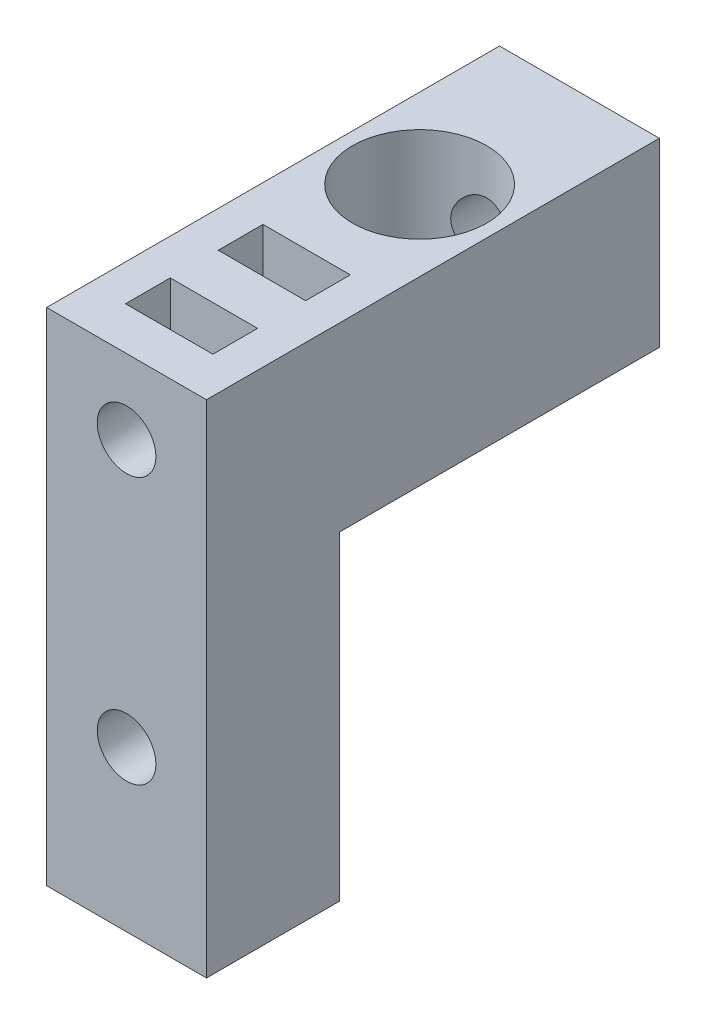
from build123d import *

# Parameters (mm, degrees)
SKETCH1_W                                       = 15
SKETCH1_H                                       = 47
BOSS_EXTRUDE1_DEPTH                             = 42.5
SKETCH2_W                                       = 30
SKETCH2_H                                       = 30
CUT_EXTRUDE1_DEPTH                              = 66.117202028
SKETCH3_R                                       = 2.75
CUT_EXTRUDE2_DEPTH                              = 15
CUT_EXTRUDE3_REACH                              = 67.117
SKETCH4_R                                       = 3.25
SKETCH5_R                                       = 2.75
CUT_EXTRUDE4_DEPTH                              = 57.482298112
CUT_EXTRUDE6_START                              = -7.2
SKETCH6_R                                       = 6.3
CUT_EXTRUDE6_DEPTH                              = 15
CSK_FOR_M6_FLAT_HEAD_MACHINE_SCREW1_D           = 6.6
CSK_FOR_M6_FLAT_HEAD_MACHINE_SCREW1_CSINK_D     = 12.6
CSK_FOR_M6_FLAT_HEAD_MACHINE_SCREW1_CSINK_ANGLE = 90
SKETCH10_W                                      = 8.2
SKETCH10_H                                      = 4.2
CUT_EXTRUDE7_DEPTH                              = 12


with BuildPart() as part:
    # Sketch1 → Boss-Extrude1 (new body)
    with BuildSketch(Plane.XY):
        with Locations((7.5, 23.5)):
            Rectangle(SKETCH1_W, SKETCH1_H)
    extrude(amount=BOSS_EXTRUDE1_DEPTH)

    # Sketch2 → Cut-Extrude1 (cut, through all)
    with BuildSketch(Plane.ZY):
        with Locations((15, 15)):
            Rectangle(SKETCH2_W, SKETCH2_H)
    extrude(amount=-CUT_EXTRUDE1_DEPTH, mode=Mode.SUBTRACT)

    # Sketch3 → Cut-Extrude2 (cut)
    with BuildSketch(Plane.XY.offset(42.5)):
        with Locations((7.5, 15)):
            Circle(SKETCH3_R)
        with Locations((7.5, 40)):
            Circle(SKETCH3_R)
    extrude(amount=-CUT_EXTRUDE2_DEPTH, mode=Mode.SUBTRACT)

    # Sketch4 → Cut-Extrude3 (cut, up to next)
    with BuildSketch(Plane(origin=(0, 47, 0), x_dir=(1, 0, 0), z_dir=(0, 1, 0)), mode=Mode.PRIVATE) as cut_extrude3_sk1:
        with Locations((7.5, -15)):
            Circle(SKETCH4_R)
    cut_extrude3_tool1 = extrude(cut_extrude3_sk1.sketch, amount=-CUT_EXTRUDE3_REACH, mode=Mode.PRIVATE) & part.part
    add(cut_extrude3_tool1.solids().sort_by_distance((7.5, 47, 15))[0], mode=Mode.SUBTRACT)

    # Sketch5 → Cut-Extrude4 (cut, through all)
    with BuildSketch(Plane.XY.offset(27.5)):
        with Locations((7.5, 40)):
            Circle(SKETCH5_R)
    extrude(amount=-CUT_EXTRUDE4_DEPTH, mode=Mode.SUBTRACT)

    # Sketch6 → Cut-Extrude6 (cut)
    with BuildSketch(Plane.XZ.offset(-30).offset(CUT_EXTRUDE6_START)):
        with Locations((7.5, 15)):
            Circle(SKETCH6_R)
    extrude(amount=-CUT_EXTRUDE6_DEPTH, mode=Mode.SUBTRACT)

    # CSK for M6 Flat Head Machine Screw1 (through all)
    with Locations(Plane(origin=(0, 37.2, 0), x_dir=(1, 0, 0), z_dir=(0, 1, 0))):
        with Locations((7.5, -15)):
            CounterSinkHole(CSK_FOR_M6_FLAT_HEAD_MACHINE_SCREW1_D / 2, CSK_FOR_M6_FLAT_HEAD_MACHINE_SCREW1_CSINK_D / 2, counter_sink_angle=CSK_FOR_M6_FLAT_HEAD_MACHINE_SCREW1_CSINK_ANGLE)

    # Sketch10 → Cut-Extrude7 (cut)
    with BuildSketch(Plane(origin=(0, 47, 0), x_dir=(1, 0, 0), z_dir=(0, 1, 0))):
        with Locations((7.5, -36.4)):
            Rectangle(SKETCH10_W, SKETCH10_H)
        with Locations((7.5, -27.7)):
            Rectangle(SKETCH10_W, SKETCH10_H)
    extrude(amount=-CUT_EXTRUDE7_DEPTH, mode=Mode.SUBTRACT)


solid = part.part
